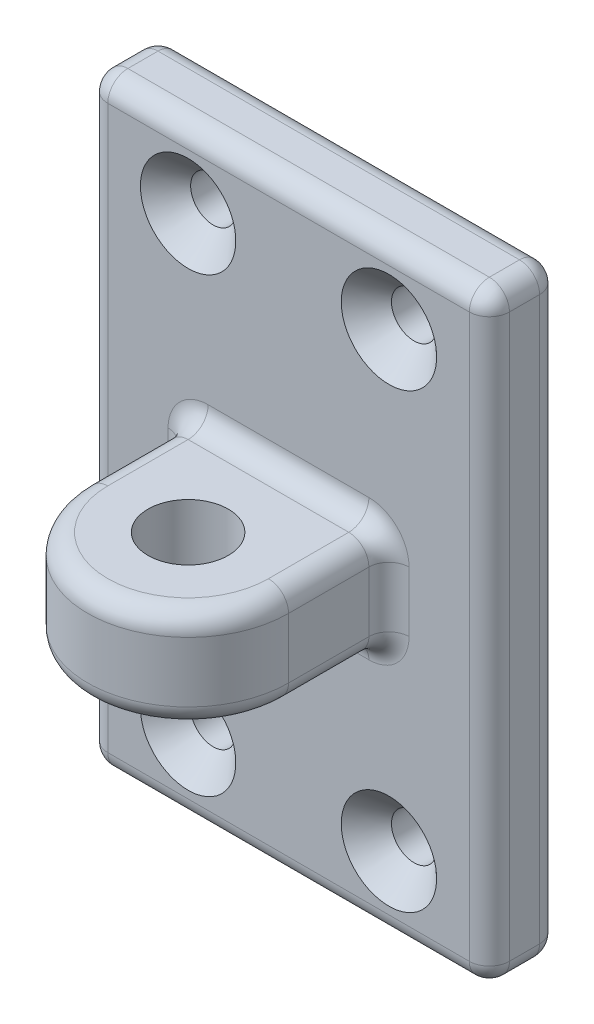
from build123d import *

# Parameters (mm, degrees)
ESQUISSE1_W             = 40
ESQUISSE1_H             = 60
ESQUISSE1_R             = 2.25
BOSS_EXTRU_1_DEPTH      = 7
BOSS_EXTRU_3_START      = -25
ESQUISSE4_R             = 4
BOSS_EXTRU_3_DEPTH      = 10
ENL_V_MAT_EXTRU_1_DEPTH = 0.3
CONG_1_R                = 2
CHANFREIN1_SIZE         = 2.5


with BuildPart() as part:
    # Esquisse1 → Boss.-Extru.1 (new body)
    with BuildSketch(Plane.XY):
        with Locations((20, 30)):
            Rectangle(ESQUISSE1_W, ESQUISSE1_H)
        with Locations((10, 52.5)):
            Circle(ESQUISSE1_R, mode=Mode.SUBTRACT)
        with Locations((30, 52.5)):
            Circle(ESQUISSE1_R, mode=Mode.SUBTRACT)
        with Locations((10, 7.5)):
            Circle(ESQUISSE1_R, mode=Mode.SUBTRACT)
        with Locations((30, 7.5)):
            Circle(ESQUISSE1_R, mode=Mode.SUBTRACT)
    extrude(amount=BOSS_EXTRU_1_DEPTH)

    # Esquisse4 → Boss.-Extru.3 (add)
    with BuildSketch(Plane(origin=(0, 60, 120), x_dir=(1, 0, 0), z_dir=(0, 1, 0)).offset(BOSS_EXTRU_3_START)):
        with BuildLine():
            Line((30, 113), (30, 103))
            ThreePointArc((30, 103), (20, 93), (10, 103))
            Line((10, 103), (10, 113))
            Line((10, 113), (30, 113))
        make_face()
        with Locations((20, 103)):
            Circle(ESQUISSE4_R, mode=Mode.SUBTRACT)
    extrude(amount=-BOSS_EXTRU_3_DEPTH)

    # Esquisse7 → Enlèv. mat.-Extru.1 (cut)
    # profile 1 of 9: a face of its own
    with BuildSketch(Plane(origin=(0, 0, 0), x_dir=(-1, 0, 0), z_dir=(0, 0, -1))):
        with BuildLine():
            add(Edge.make_bspline(
                [(-22.253937988, 36.824583435), (-22.252071419, 36.853414647), (-22.248392709, 36.910236353), (-22.211239144, 36.990034413), (-22.153139807, 37.061166535), (-22.101559217, 37.097875597), (-22.074395895, 37.117207289)],
                knots=[0, 0, 0, 0, 0.959160072, 1.890351017, 2.889018652, 4, 4, 4, 4], degree=3))
            add(Edge.make_bspline(
                [(-22.074395895, 37.117207289), (-22.044987646, 37.133814905), (-21.979332884, 37.170891885), (-21.862164241, 37.213972108), (-21.721025867, 37.258213691), (-21.617324146, 37.2819836), (-21.561560192, 37.294765491)],
                knots=[0, 0, 0, 0, 0.742751013, 1.658213032, 2.74074123, 4, 4, 4, 4], degree=3))
            Line((-21.561560192, 37.294765491), (-20.986231937, 37.412806978))
            add(Edge.make_bspline(
                [(-20.986231937, 37.412806978), (-20.962135093, 37.418933513), (-20.911131971, 37.431900872), (-20.828702203, 37.448878963), (-20.737221656, 37.470732858), (-20.634380226, 37.490645346), (-20.522212237, 37.514069733), (-20.399310947, 37.536372048), (-20.266713295, 37.561113674), (-20.124101058, 37.588494513), (-19.971082471, 37.614503687), (-19.808540982, 37.643716143), (-19.635612479, 37.673497141), (-19.45230755, 37.703832536), (-19.258993728, 37.736923927), (-19.055621681, 37.770517793), (-18.842360147, 37.80528199), (-18.69682949, 37.828476899), (-18.622426367, 37.840335388)],
                knots=[0, 0, 0, 0, 0.496658207, 1.051221438, 1.68101768, 2.375400972, 3.143623008, 3.970205625, 4.870641242, 5.838436678, 6.871229342, 7.971369117, 9.137717576, 10.376808206, 11.683232474, 13.055897193, 14.494815811, 16, 16, 16, 16], degree=3))
            Line((-18.622426367, 37.840335388), (-20.641034985, 38.520809841))
            Line((-20.641034985, 38.520809841), (-21.276871901, 38.72217473))
            add(Edge.make_bspline(
                [(-21.276871901, 38.72217473), (-21.337268664, 38.742069704), (-21.452965474, 38.780180768), (-21.615973654, 38.844604746), (-21.76301033, 38.907616934), (-21.853115764, 38.95475212), (-21.895845747, 38.977104664)],
                knots=[0, 0, 0, 0, 1.138108356, 2.180174859, 3.13699879, 4, 4, 4, 4], degree=3))
            add(Edge.make_bspline(
                [(-21.895845747, 38.977104664), (-21.914407092, 38.988832162), (-21.950432858, 39.011594095), (-21.9967196, 39.053083085), (-22.037511358, 39.095872955), (-22.070413933, 39.142591347), (-22.095402933, 39.192899624), (-22.113337786, 39.245946321), (-22.124586371, 39.301995935), (-22.126165432, 39.340434614), (-22.126968994, 39.359995537)],
                knots=[0, 0, 0, 0, 1.12138879, 2.176506675, 3.170017907, 4.141537379, 5.087232601, 6.03413754, 6.999599269, 8, 8, 8, 8], degree=3))
            add(Edge.make_bspline(
                [(-22.126968994, 39.359995537), (-22.124831457, 39.391791165), (-22.1206333, 39.454238292), (-22.082399688, 39.541624172), (-22.020741183, 39.6179114), (-21.965485769, 39.654997856), (-21.936515503, 39.674442186)],
                knots=[0, 0, 0, 0, 0.986319395, 1.937147192, 2.918451782, 4, 4, 4, 4], degree=3))
            add(Edge.make_bspline(
                [(-21.936515503, 39.674442186), (-21.91153943, 39.687008268), (-21.859402004, 39.7132399), (-21.77440459, 39.747606444), (-21.680068164, 39.780447374), (-21.61324991, 39.799444936), (-21.578423262, 39.809346743)],
                knots=[0, 0, 0, 0, 0.874803538, 1.826147944, 2.866956585, 4, 4, 4, 4], degree=3))
            Line((-21.578423262, 39.809346743), (-21.206443787, 39.906557379))
            add(Edge.make_bspline(
                [(-21.206443787, 39.906557379), (-21.006312241, 39.962347591), (-20.600305436, 40.075529179), (-19.977879553, 40.230817259), (-19.334529847, 40.375733433), (-18.897392154, 40.462658571), (-18.675991411, 40.506684265)],
                knots=[0, 0, 0, 0, 0.958328754, 1.944161251, 2.958762347, 4, 4, 4, 4], degree=3))
            Line((-18.675991411, 40.506684265), (-19.270166626, 40.624725752))
            Line((-19.270166626, 40.624725752), (-21.023925858, 41.04630249))
            add(Edge.make_bspline(
                [(-21.023925858, 41.04630249), (-21.051061327, 41.048748338), (-21.108754278, 41.053948474), (-21.199598439, 41.066458838), (-21.299898744, 41.081006332), (-21.409322648, 41.100159342), (-21.527943536, 41.1231192), (-21.655897976, 41.148961143), (-21.793225669, 41.177587805), (-21.88761048, 41.19892019), (-21.936515503, 41.209973459)],
                knots=[0, 0, 0, 0, 0.704684958, 1.498236636, 2.371575818, 3.326349705, 4.371405418, 5.496944069, 6.703053969, 8, 8, 8, 8], degree=3))
            add(Edge.make_bspline(
                [(-21.936515503, 41.209973459), (-21.956601235, 41.218405287), (-21.995168196, 41.234595385), (-22.046778651, 41.26580711), (-22.091752398, 41.299410243), (-22.127717285, 41.338602842), (-22.156070857, 41.381777224), (-22.176052784, 41.429153725), (-22.188347034, 41.480483387), (-22.189739459, 41.516083764), (-22.190453491, 41.534339561)],
                knots=[0, 0, 0, 0, 1.182980922, 2.271462135, 3.271240398, 4.225523803, 5.148115151, 6.066492127, 7.00850128, 8, 8, 8, 8], degree=3))
            add(Edge.make_bspline(
                [(-22.190453491, 41.534339561), (-22.189374089, 41.56000286), (-22.187296915, 41.609388632), (-22.164067877, 41.67867748), (-22.128132918, 41.740728445), (-22.09320304, 41.772874249), (-22.07538784, 41.789269495)],
                knots=[0, 0, 0, 0, 1.060616523, 2.041022336, 3.000867405, 4, 4, 4, 4], degree=3))
            add(Edge.make_bspline(
                [(-22.07538784, 41.789269495), (-22.058638609, 41.801919164), (-22.024814605, 41.827464362), (-21.965273111, 41.852357039), (-21.900762872, 41.869359717), (-21.855626877, 41.870838635), (-21.83236125, 41.871600952)],
                knots=[0, 0, 0, 0, 0.958743918, 1.936122096, 2.936161401, 4, 4, 4, 4], degree=3))
            add(Edge.make_bspline(
                [(-21.83236125, 41.871600952), (-21.785397772, 41.870619292), (-21.68873458, 41.868598776), (-21.540050787, 41.858811302), (-21.383638851, 41.840244312), (-21.219512745, 41.815640525), (-21.04726384, 41.783350492), (-20.867124233, 41.745162707), (-20.679575013, 41.69783347), (-20.552364136, 41.66317076), (-20.487283468, 41.645437431)],
                knots=[0, 0, 0, 0, 0.824042072, 1.69609536, 2.612788883, 3.586582681, 4.607146524, 5.686861406, 6.816605879, 8, 8, 8, 8], degree=3))
            Line((-20.487283468, 41.645437431), (-19.13724596, 41.2853613))
            Line((-19.13724596, 41.2853613), (-18.082808142, 41.095899754))
            add(Edge.make_bspline(
                [(-18.082808142, 41.095899754), (-18.023912348, 41.083858815), (-17.910869295, 41.06074775), (-17.749592823, 41.024588889), (-17.604300296, 40.987037257), (-17.475377129, 40.948311948), (-17.362259958, 40.910247812), (-17.26522103, 40.871309245), (-17.183233349, 40.833220129), (-17.136862595, 40.802460345), (-17.115661507, 40.788396721)],
                knots=[0, 0, 0, 0, 1.41391691, 2.713835346, 3.887123202, 4.942664059, 5.879701372, 6.692772478, 7.402324893, 8, 8, 8, 8], degree=3))
            add(Edge.make_bspline(
                [(-17.115661507, 40.788396721), (-17.086057886, 40.766171226), (-17.030169094, 40.724211627), (-16.967278791, 40.644034816), (-16.92770822, 40.55539417), (-16.923397914, 40.492525806), (-16.921240234, 40.461054783)],
                knots=[0, 0, 0, 0, 1.115644301, 2.106229269, 3.052004878, 4, 4, 4, 4], degree=3))
            add(Edge.make_bspline(
                [(-16.921240234, 40.461054783), (-16.921934028, 40.443451275), (-16.923286334, 40.409139405), (-16.935822172, 40.359976839), (-16.954832282, 40.314274547), (-16.982123382, 40.271743861), (-17.018488935, 40.233446633), (-17.061247641, 40.197588224), (-17.111687086, 40.165061535), (-17.149446664, 40.148395048), (-17.169226551, 40.139664516)],
                knots=[0, 0, 0, 0, 0.974792575, 1.900016553, 2.795872551, 3.711595558, 4.685006917, 5.713528267, 6.802260137, 8, 8, 8, 8], degree=3))
            add(Edge.make_bspline(
                [(-17.169226551, 40.139664516), (-17.197192493, 40.128052016), (-17.258582933, 40.10256042), (-17.362550133, 40.069541233), (-17.485682046, 40.036675724), (-17.627600747, 40.000386992), (-17.789451668, 39.965105235), (-17.97082949, 39.929868163), (-18.171204498, 39.893092016), (-18.311255926, 39.869351901), (-18.384359503, 39.856960115)],
                knots=[0, 0, 0, 0, 0.581236301, 1.275921689, 2.09225498, 3.028489211, 4.088314635, 5.272448532, 6.576281799, 8, 8, 8, 8], degree=3))
            add(Edge.make_bspline(
                [(-18.384359503, 39.856960115), (-18.477019725, 39.841525554), (-18.664674237, 39.810267642), (-18.948091238, 39.75465888), (-19.238035599, 39.695788765), (-19.533375969, 39.629350667), (-19.833942599, 39.555159628), (-20.140800989, 39.477384099), (-20.452859279, 39.391965), (-20.662274753, 39.331171905), (-20.768003979, 39.300478821)],
                knots=[0, 0, 0, 0, 0.920409794, 1.864004282, 2.829825251, 3.819421933, 4.829969225, 5.863304241, 6.92122972, 8, 8, 8, 8], degree=3))
            add(Edge.make_bspline(
                [(-20.768003979, 39.300478821), (-20.551561346, 39.21819894), (-20.11626624, 39.052723087), (-19.45125436, 38.826401862), (-18.772890769, 38.616322115), (-18.31365355, 38.491369191), (-18.082808142, 38.428558931)],
                knots=[0, 0, 0, 0, 0.983642058, 1.97823584, 2.98371701, 4, 4, 4, 4], degree=3))
            Line((-18.082808142, 38.428558931), (-17.593779125, 38.326388569))
            add(Edge.make_bspline(
                [(-17.593779125, 38.326388569), (-17.546986854, 38.316123128), (-17.457359673, 38.296460424), (-17.331476115, 38.258052006), (-17.218244361, 38.218223735), (-17.150719633, 38.1832853), (-17.118637342, 38.166685381)],
                knots=[0, 0, 0, 0, 1.142374087, 2.188134223, 3.139147904, 4, 4, 4, 4], degree=3))
            add(Edge.make_bspline(
                [(-17.118637342, 38.166685381), (-17.097803607, 38.155995248), (-17.057755338, 38.135445821), (-17.005302904, 38.096965799), (-16.959811883, 38.057371618), (-16.92227715, 38.014242045), (-16.893412052, 37.967219922), (-16.872251625, 37.917492399), (-16.859883428, 37.864410516), (-16.858476853, 37.828166486), (-16.857755737, 37.809585085)],
                knots=[0, 0, 0, 0, 1.1989224, 2.304664292, 3.325509931, 4.287341643, 5.223729972, 6.14323389, 7.048082794, 8, 8, 8, 8], degree=3))
            add(Edge.make_bspline(
                [(-16.857755737, 37.809585085), (-16.859469498, 37.78618142), (-16.862914819, 37.739131025), (-16.891678827, 37.671748551), (-16.938178183, 37.61045715), (-17.00136723, 37.55302969), (-17.082989808, 37.501156698), (-17.181544506, 37.452962668), (-17.297916687, 37.409271331), (-17.382283408, 37.385673599), (-17.42713232, 37.373129168)],
                knots=[0, 0, 0, 0, 0.729436865, 1.466449471, 2.249901209, 3.120352387, 4.120811242, 5.2624927, 6.544755269, 8, 8, 8, 8], degree=3))
            add(Edge.make_bspline(
                [(-17.42713232, 37.373129168), (-17.444939994, 37.368298777), (-17.484909768, 37.357456844), (-17.552042615, 37.344587488), (-17.631679301, 37.329481726), (-17.723880479, 37.31350946), (-17.829149377, 37.298044594), (-17.946865275, 37.28121203), (-18.077455378, 37.263217182), (-18.168767781, 37.251382989), (-18.216720753, 37.245168228)],
                knots=[0, 0, 0, 0, 0.553116127, 1.241483132, 2.04851274, 2.984162884, 4.047067603, 5.238941889, 6.55002235, 8, 8, 8, 8], degree=3))
            add(Edge.make_bspline(
                [(-18.216720753, 37.245168228), (-18.34078334, 37.229127677), (-18.584221989, 37.197652515), (-18.941743464, 37.142902618), (-19.285650796, 37.088671827), (-19.615361696, 37.028041086), (-19.931876049, 36.967734403), (-20.234135141, 36.901368997), (-20.523313883, 36.835162291), (-20.710270582, 36.785428697), (-20.801730118, 36.761098938)],
                knots=[0, 0, 0, 0, 1.140679443, 2.238269145, 3.298055813, 4.315294308, 5.295118381, 6.236017322, 7.137056661, 8, 8, 8, 8], degree=3))
            Line((-20.801730118, 36.761098938), (-21.377058372, 36.600403805))
            add(Edge.make_bspline(
                [(-21.377058372, 36.600403805), (-21.412385078, 36.59028752), (-21.479247802, 36.571140465), (-21.575135116, 36.546920471), (-21.659765477, 36.524313883), (-21.73447518, 36.508096482), (-21.797789566, 36.493676801), (-21.850383071, 36.483803644), (-21.892371036, 36.47704518), (-21.91699083, 36.475908126), (-21.927587996, 36.475418701)],
                knots=[0, 0, 0, 0, 1.559836002, 2.952295785, 4.198319056, 5.277771974, 6.19735914, 6.954427167, 7.549951206, 8, 8, 8, 8], degree=3))
            add(Edge.make_bspline(
                [(-21.927587996, 36.475418701), (-21.949886053, 36.476786524), (-21.993747771, 36.479477119), (-22.056786135, 36.499920679), (-22.113351769, 36.534718451), (-22.162402083, 36.581403), (-22.202438568, 36.636055357), (-22.23176939, 36.695843744), (-22.25062122, 36.75897589), (-22.252828206, 36.802631313), (-22.253937988, 36.824583435)],
                knots=[0, 0, 0, 0, 1.009991958, 1.986719327, 2.968954602, 3.997799753, 5.038376203, 6.024038288, 7.006387982, 8, 8, 8, 8], degree=3))
        make_face()
    # profile 2 of 9: a face of its own
    with BuildSketch(Plane(origin=(0, 0, 0), x_dir=(-1, 0, 0), z_dir=(0, 0, -1))):
        with BuildLine():
            add(Edge.make_bspline(
                [(-17.746538696, 35.203744869), (-17.745292914, 35.22903295), (-17.742854226, 35.278535736), (-17.720852992, 35.349771424), (-17.685396961, 35.415412113), (-17.637042851, 35.474038603), (-17.579059821, 35.524056172), (-17.51289209, 35.559555183), (-17.441292019, 35.583359493), (-17.391287813, 35.58552478), (-17.365631714, 35.586635742)],
                knots=[0, 0, 0, 0, 1.011043888, 1.979173117, 2.957131321, 3.983335684, 5.007828563, 6.003745504, 6.975764089, 8, 8, 8, 8], degree=3))
            add(Edge.make_bspline(
                [(-17.365631714, 35.586635742), (-17.339984089, 35.585509899), (-17.289996401, 35.583315609), (-17.218554589, 35.559813553), (-17.153072548, 35.52371159), (-17.095109154, 35.474122693), (-17.047064643, 35.41511353), (-17.010192798, 35.350071328), (-16.988478377, 35.27849736), (-16.985993904, 35.229019974), (-16.984724731, 35.203744869)],
                knots=[0, 0, 0, 0, 1.024909736, 1.997567794, 2.98252313, 4.007690004, 5.034569487, 6.019524822, 6.988290965, 8, 8, 8, 8], degree=3))
            add(Edge.make_bspline(
                [(-16.984724731, 35.203744869), (-16.985990643, 35.178467347), (-16.988468734, 35.128985229), (-17.01022972, 35.057445786), (-17.046794887, 34.99249335), (-17.095186411, 34.934328313), (-17.153123021, 34.88571462), (-17.218632454, 34.850540702), (-17.290162582, 34.828397901), (-17.340007445, 34.82603599), (-17.365631714, 34.824821777)],
                knots=[0, 0, 0, 0, 1.015389577, 1.987680038, 2.976218587, 3.99656407, 5.016909553, 5.999071237, 6.971361698, 8, 8, 8, 8], degree=3))
            add(Edge.make_bspline(
                [(-17.365631714, 34.824821777), (-17.391264216, 34.82602111), (-17.441125097, 34.828354077), (-17.512820662, 34.850793462), (-17.579002032, 34.885374307), (-17.636967689, 34.934410915), (-17.685662311, 34.992197384), (-17.720815854, 35.057745791), (-17.742863952, 35.128946807), (-17.745296202, 35.178454356), (-17.746538696, 35.203744869)],
                knots=[0, 0, 0, 0, 1.02794996, 1.999589787, 2.992820247, 4.012482938, 5.032145629, 6.013650072, 6.985289899, 8, 8, 8, 8], degree=3))
        make_face()
    # profile 3 of 9: a face of its own
    with BuildSketch(Plane(origin=(0, 0, 0), x_dir=(-1, 0, 0), z_dir=(0, 0, -1))):
        with BuildLine():
            add(Edge.make_bspline(
                [(-20.470420399, 35.015275269), (-20.50778367, 35.015275269), (-20.591107073, 35.015275269), (-20.728326168, 35.015275269), (-20.890674543, 35.015275269), (-21.069224691, 35.015275269), (-21.247774839, 35.015275269), (-21.409461918, 35.015275269), (-21.546350365, 35.015275269), (-21.629343119, 35.015275269), (-21.66670639, 35.015275269)],
                knots=[0, 0, 0, 0, 0.749585406, 1.671641791, 2.752902156, 4.006633499, 5.253731343, 6.334991708, 7.250414594, 8, 8, 8, 8], degree=3))
            add(Edge.make_bspline(
                [(-21.66670639, 35.015275269), (-21.690275956, 35.016461955), (-21.735346654, 35.018731185), (-21.80021069, 35.034952184), (-21.857774447, 35.062839505), (-21.908386629, 35.100963529), (-21.948948415, 35.148436345), (-21.978571102, 35.203900782), (-21.996865683, 35.266091649), (-21.998935983, 35.310086747), (-22, 35.332697754)],
                knots=[0, 0, 0, 0, 1.094717351, 2.093363834, 3.08286838, 4.047734091, 5.017601985, 5.959315965, 6.95120314, 8, 8, 8, 8], degree=3))
            add(Edge.make_bspline(
                [(-22, 35.332697754), (-21.998949762, 35.354986778), (-21.99690655, 35.398349513), (-21.978339825, 35.459761408), (-21.949005289, 35.515022049), (-21.908103466, 35.562441106), (-21.857869985, 35.601494496), (-21.800446387, 35.630631282), (-21.735320713, 35.646602045), (-21.690267048, 35.648912168), (-21.66670639, 35.650120239)],
                knots=[0, 0, 0, 0, 1.035292228, 2.01413497, 2.957488023, 3.929043993, 4.904978555, 5.902992621, 6.903377269, 8, 8, 8, 8], degree=3))
            add(Edge.make_bspline(
                [(-21.66670639, 35.650120239), (-21.629343119, 35.650120239), (-21.546350365, 35.650120239), (-21.409461918, 35.650120239), (-21.247774839, 35.650120239), (-21.069224691, 35.650120239), (-20.890674543, 35.650120239), (-20.728326168, 35.650120239), (-20.591107073, 35.650120239), (-20.50778367, 35.650120239), (-20.470420399, 35.650120239)],
                knots=[0, 0, 0, 0, 0.749585406, 1.665008292, 2.746268657, 3.993366501, 5.247097844, 6.328358209, 7.250414594, 8, 8, 8, 8], degree=3))
            add(Edge.make_bspline(
                [(-20.470420399, 35.650120239), (-20.415197601, 35.649693656), (-20.298111112, 35.648789191), (-20.11259634, 35.642337347), (-19.907568936, 35.632515748), (-19.689759474, 35.618378018), (-19.471950011, 35.604240128), (-19.26692261, 35.594418956), (-19.081077373, 35.587954275), (-18.963660102, 35.587059219), (-18.908106604, 35.586635742)],
                knots=[0, 0, 0, 0, 0.847472393, 1.796858752, 2.848468188, 3.99746302, 5.146457853, 6.198067289, 7.147453648, 8, 8, 8, 8], degree=3))
            add(Edge.make_bspline(
                [(-18.908106604, 35.586635742), (-18.884242991, 35.58535567), (-18.838269394, 35.582889593), (-18.772097528, 35.567853207), (-18.71473363, 35.537346334), (-18.663658553, 35.499411194), (-18.623146987, 35.451176662), (-18.591986287, 35.396769695), (-18.57533105, 35.334634276), (-18.573025001, 35.291454898), (-18.571837158, 35.269213257)],
                knots=[0, 0, 0, 0, 1.105496077, 2.129754222, 3.108305544, 4.090677482, 5.056586269, 6.001791546, 6.970725423, 8, 8, 8, 8], degree=3))
            add(Edge.make_bspline(
                [(-18.571837158, 35.269213257), (-18.572969044, 35.24695182), (-18.57515026, 35.204052609), (-18.592465039, 35.142204897), (-18.622789205, 35.087366116), (-18.663746984, 35.039138256), (-18.714432066, 35.000781293), (-18.772547969, 34.972107521), (-18.8380588, 34.955116841), (-18.884198849, 34.95292598), (-18.908106604, 34.951790771)],
                knots=[0, 0, 0, 0, 1.029841539, 1.984570475, 2.943708136, 3.910148981, 4.893062045, 5.865305939, 6.893894976, 8, 8, 8, 8], degree=3))
            add(Edge.make_bspline(
                [(-18.908106604, 34.951790771), (-18.963660102, 34.952214248), (-19.081077373, 34.953109304), (-19.26692261, 34.959573985), (-19.471950011, 34.969395157), (-19.689759474, 34.983533048), (-19.907568936, 34.997670778), (-20.11259634, 35.007492376), (-20.298111112, 35.01394422), (-20.415197601, 35.014848686), (-20.470420399, 35.015275269)],
                knots=[0, 0, 0, 0, 0.852546352, 1.801932711, 2.853542147, 4.00253698, 5.151531812, 6.203141248, 7.152527607, 8, 8, 8, 8], degree=3))
        make_face()
    # profile 4 of 9: a face of its own
    with BuildSketch(Plane(origin=(0, 0, 0), x_dir=(-1, 0, 0), z_dir=(0, 0, -1))):
        with BuildLine():
            add(Edge.make_bspline(
                [(-22.253937988, 31.306391916), (-22.253143175, 31.330631914), (-22.251634328, 31.376648284), (-22.236112179, 31.441251435), (-22.212716634, 31.498582209), (-22.177226856, 31.546729022), (-22.132212177, 31.586519348), (-22.077815231, 31.617285384), (-22.013569828, 31.639425687), (-21.967103842, 31.646726154), (-21.942467175, 31.650596924)],
                knots=[0, 0, 0, 0, 1.120660435, 2.127422838, 3.060545721, 3.970376627, 4.870878344, 5.824514606, 6.846538862, 8, 8, 8, 8], degree=3))
            Line((-21.942467175, 31.650596924), (-21.216363239, 31.734912271))
            add(Edge.make_bspline(
                [(-21.216363239, 31.734912271), (-21.152583858, 31.741601794), (-21.027484814, 31.754722851), (-20.842521842, 31.767133003), (-20.663927713, 31.775582013), (-20.546809438, 31.776912318), (-20.489267359, 31.777565918)],
                knots=[0, 0, 0, 0, 1.056006236, 2.071286475, 3.052392247, 4, 4, 4, 4], degree=3))
            add(Edge.make_bspline(
                [(-20.489267359, 31.777565918), (-20.471081372, 31.777259803), (-20.429413499, 31.776558431), (-20.358961679, 31.774719041), (-20.272362522, 31.770256406), (-20.174815314, 31.765797354), (-20.076981985, 31.760556744), (-19.98999275, 31.757909138), (-19.919238013, 31.755707734), (-19.87756872, 31.755041817), (-19.859382114, 31.754751177)],
                knots=[0, 0, 0, 0, 0.692528654, 1.586727018, 2.683157443, 3.993962047, 5.304766651, 6.413272982, 7.307471346, 8, 8, 8, 8], degree=3))
            add(Edge.make_bspline(
                [(-19.859382114, 31.754751177), (-19.803478631, 31.755344006), (-19.698772931, 31.756454358), (-19.552771952, 31.768741231), (-19.428865545, 31.790126107), (-19.32694406, 31.818395751), (-19.246449485, 31.856036476), (-19.187003166, 31.90257533), (-19.149109538, 31.96139506), (-19.145162469, 32.004891706), (-19.143197632, 32.02654418)],
                knots=[0, 0, 0, 0, 1.610028399, 3.015539292, 4.214974549, 5.227582408, 6.053934297, 6.757560469, 7.381518064, 8, 8, 8, 8], degree=3))
            add(Edge.make_bspline(
                [(-19.143197632, 32.02654418), (-19.144537355, 32.058401161), (-19.147231256, 32.12245883), (-19.169273433, 32.217600869), (-19.204039994, 32.311419103), (-19.253955127, 32.403558488), (-19.316489389, 32.494624972), (-19.393219831, 32.584663334), (-19.483188187, 32.673984978), (-19.55135477, 32.729108672), (-19.586597166, 32.757607841)],
                knots=[0, 0, 0, 0, 0.862908479, 1.73512694, 2.634339985, 3.568791753, 4.56840037, 5.624425298, 6.771818386, 8, 8, 8, 8], degree=3))
            add(Edge.make_bspline(
                [(-19.586597166, 32.757607841), (-19.621071006, 32.783403836), (-19.690719184, 32.83551999), (-19.80120407, 32.908530195), (-19.919755046, 32.97492544), (-20.042985216, 33.040235656), (-20.174441453, 33.098335149), (-20.311470902, 33.153982844), (-20.455892616, 33.20466036), (-20.554944926, 33.23445734), (-20.605324955, 33.249612694)],
                knots=[0, 0, 0, 0, 0.907885794, 1.83421954, 2.789873648, 3.772244316, 4.774021227, 5.818912256, 6.890654207, 8, 8, 8, 8], degree=3))
            add(Edge.make_bspline(
                [(-20.605324955, 33.249612694), (-20.628469446, 33.25127081), (-20.677413967, 33.254777292), (-20.754894861, 33.260223306), (-20.840464382, 33.269705326), (-20.900268144, 33.27669321), (-20.931674948, 33.280362997)],
                knots=[0, 0, 0, 0, 0.849325914, 1.796101322, 2.842590997, 4, 4, 4, 4], degree=3))
            add(Edge.make_bspline(
                [(-20.931674948, 33.280362997), (-20.986173741, 33.286563496), (-21.093627394, 33.298788837), (-21.201759763, 33.300399894), (-21.255049105, 33.301193848)],
                knots=[0, 0, 0, 0, 1.014368362, 2, 2, 2, 2], degree=3))
            add(Edge.make_bspline(
                [(-21.255049105, 33.301193848), (-21.273570222, 33.301013514), (-21.314946672, 33.300610646), (-21.38341835, 33.296211941), (-21.464710013, 33.288963696), (-21.554302065, 33.280553223), (-21.643793206, 33.271240628), (-21.724873426, 33.265812138), (-21.79362013, 33.261028818), (-21.835330714, 33.260681211), (-21.854184046, 33.260524092)],
                knots=[0, 0, 0, 0, 0.739853185, 1.65284295, 2.739966305, 4.000493185, 5.247870011, 6.333949561, 7.246939326, 8, 8, 8, 8], degree=3))
            add(Edge.make_bspline(
                [(-21.854184046, 33.260524092), (-21.87809104, 33.261660095), (-21.924229623, 33.26385249), (-21.98975068, 33.280832478), (-22.047830218, 33.30954427), (-22.098853685, 33.347912998), (-22.13912892, 33.396571527), (-22.168851153, 33.451825545), (-22.187246879, 33.512980672), (-22.189370061, 33.55599629), (-22.190453491, 33.577946577)],
                knots=[0, 0, 0, 0, 1.106844813, 2.136121794, 3.109015947, 4.092586406, 5.071372934, 6.010386962, 6.98472744, 8, 8, 8, 8], degree=3))
            add(Edge.make_bspline(
                [(-22.190453491, 33.577946577), (-22.189452046, 33.600582575), (-22.187517575, 33.644308058), (-22.168487676, 33.706148859), (-22.14008262, 33.762045743), (-22.098018474, 33.808854609), (-22.048012032, 33.847962077), (-21.988654148, 33.874469648), (-21.923350925, 33.892416099), (-21.877129729, 33.893708033), (-21.853192101, 33.894377117)],
                knots=[0, 0, 0, 0, 1.042299657, 2.013388355, 2.96274755, 3.915048982, 4.895336855, 5.872170274, 6.898012127, 8, 8, 8, 8], degree=3))
            add(Edge.make_bspline(
                [(-21.853192101, 33.894377117), (-21.834340142, 33.89455149), (-21.792632596, 33.894937269), (-21.723831516, 33.899366817), (-21.642536208, 33.906570278), (-21.552632799, 33.91521002), (-21.462728736, 33.923838014), (-21.381106241, 33.931099655), (-21.311969943, 33.935456427), (-21.269932965, 33.935858505), (-21.251081324, 33.936038818)],
                knots=[0, 0, 0, 0, 0.749259206, 1.657640177, 2.739275709, 3.993439419, 5.24760313, 6.329238662, 7.250740794, 8, 8, 8, 8], degree=3))
            add(Edge.make_bspline(
                [(-21.251081324, 33.936038818), (-21.220990438, 33.936206716), (-21.158156633, 33.936557309), (-21.059973492, 33.933672177), (-20.953466251, 33.93260841), (-20.838447795, 33.927611761), (-20.715054115, 33.924675841), (-20.583525489, 33.917639016), (-20.443583578, 33.912715885), (-20.297863518, 33.90377686), (-20.15198064, 33.8978977), (-20.011860939, 33.889915613), (-19.880193568, 33.885963367), (-19.756920169, 33.879959896), (-19.641804424, 33.877940715), (-19.535038806, 33.874022367), (-19.436479903, 33.873714082), (-19.373658749, 33.872929904), (-19.343570576, 33.872554321)],
                knots=[0, 0, 0, 0, 0.756649984, 1.579986608, 2.469829357, 3.434923482, 4.47480987, 5.573501345, 6.746954068, 7.995951889, 9.244534489, 10.41837011, 11.525024358, 12.556901746, 13.52174511, 14.420093674, 15.243304331, 16, 16, 16, 16], degree=3))
            add(Edge.make_bspline(
                [(-19.343570576, 33.872554321), (-19.323399893, 33.872834488), (-19.279084711, 33.873450016), (-19.20601524, 33.875671082), (-19.120344842, 33.878274813), (-19.025824422, 33.883629985), (-18.931585475, 33.888124842), (-18.845647196, 33.892608961), (-18.772877798, 33.894387304), (-18.728564777, 33.895065452), (-18.708725605, 33.895369062)],
                knots=[0, 0, 0, 0, 0.762046719, 1.674223902, 2.761577294, 3.999751615, 5.250401086, 6.325779014, 7.250442466, 8, 8, 8, 8], degree=3))
            add(Edge.make_bspline(
                [(-18.708725605, 33.895369062), (-18.685770846, 33.894372579), (-18.641007285, 33.892429359), (-18.577227515, 33.872914062), (-18.520115441, 33.840540113), (-18.472038734, 33.795025576), (-18.43148242, 33.742386985), (-18.401728213, 33.682174588), (-18.384820806, 33.615564018), (-18.382551445, 33.569114544), (-18.381383667, 33.545212383)],
                knots=[0, 0, 0, 0, 1.026010766, 2.000800635, 2.956263305, 3.941799919, 4.946194384, 5.920083338, 6.929707924, 8, 8, 8, 8], degree=3))
            add(Edge.make_bspline(
                [(-18.381383667, 33.545212383), (-18.382716002, 33.519313334), (-18.385270543, 33.469656044), (-18.404773412, 33.399054798), (-18.441070475, 33.339473429), (-18.48901204, 33.287769148), (-18.551957594, 33.247352538), (-18.628093757, 33.216838337), (-18.717309266, 33.195146653), (-18.781674732, 33.188608373), (-18.815855694, 33.185136251)],
                knots=[0, 0, 0, 0, 0.981438758, 1.881752029, 2.741463425, 3.601448804, 4.532970262, 5.550009211, 6.698944533, 8, 8, 8, 8], degree=3))
            Line((-18.815855694, 33.185136251), (-19.206682129, 33.174224854))
            add(Edge.make_bspline(
                [(-19.206682129, 33.174224854), (-19.146462375, 33.1271286), (-19.030753479, 33.036635776), (-18.874821885, 32.892320215), (-18.742961129, 32.746459995), (-18.634999295, 32.599346109), (-18.549693416, 32.45139852), (-18.4899661, 32.301791207), (-18.451748285, 32.150787604), (-18.447152615, 32.049245197), (-18.444868164, 31.998769712)],
                knots=[0, 0, 0, 0, 1.263598251, 2.427933541, 3.508005564, 4.509617483, 5.439945349, 6.323141168, 7.166454043, 8, 8, 8, 8], degree=3))
            add(Edge.make_bspline(
                [(-18.444868164, 31.998769712), (-18.445919483, 31.955006524), (-18.447958205, 31.870140781), (-18.471683479, 31.748470188), (-18.50804288, 31.636597098), (-18.560257803, 31.535103618), (-18.627304738, 31.444081425), (-18.70926903, 31.363449612), (-18.805977103, 31.293495346), (-18.878752039, 31.257423153), (-18.916042166, 31.238939638)],
                knots=[0, 0, 0, 0, 1.102560814, 2.138090143, 3.114024346, 4.061564928, 5.004136339, 5.953730576, 6.951484528, 8, 8, 8, 8], degree=3))
            add(Edge.make_bspline(
                [(-18.916042166, 31.238939638), (-18.943619009, 31.226844199), (-19.000808833, 31.201760255), (-19.094255095, 31.173073447), (-19.195943636, 31.145802844), (-19.307752054, 31.124514813), (-19.428561551, 31.106877308), (-19.558900863, 31.092749646), (-19.69860888, 31.084495548), (-19.794898684, 31.081024553), (-19.844502935, 31.07923645)],
                knots=[0, 0, 0, 0, 0.76165536, 1.579547541, 2.470768388, 3.426104039, 4.458278625, 5.560971179, 6.743520153, 8, 8, 8, 8], degree=3))
            Line((-19.844502935, 31.07923645), (-20.182756271, 31.07923645))
            Line((-20.182756271, 31.07923645), (-20.49323514, 31.083204231))
            add(Edge.make_bspline(
                [(-20.49323514, 31.083204231), (-20.542850334, 31.082324255), (-20.648815964, 31.080444845), (-20.817923916, 31.067750097), (-21.007083433, 31.046634773), (-21.209433451, 31.017875583), (-21.411342835, 30.988357977), (-21.60037096, 30.969371423), (-21.768650353, 30.954714518), (-21.874327329, 30.953045819), (-21.923620214, 30.952267456)],
                knots=[0, 0, 0, 0, 0.828340741, 1.76912841, 2.829861241, 4.005596384, 5.181331526, 6.235985114, 7.177177593, 8, 8, 8, 8], degree=3))
            add(Edge.make_bspline(
                [(-21.923620214, 30.952267456), (-21.947296368, 30.95305836), (-21.992935873, 30.95458295), (-22.056850733, 30.976409058), (-22.115384345, 31.006827248), (-22.164238504, 31.052100404), (-22.204283747, 31.105963056), (-22.233387384, 31.167247881), (-22.250535011, 31.235046178), (-22.252781972, 31.282155236), (-22.253937988, 31.306391916)],
                knots=[0, 0, 0, 0, 1.042822364, 2.010203863, 2.959819381, 3.94432012, 4.92784131, 5.916358886, 6.928007818, 8, 8, 8, 8], degree=3))
        make_face()
    # profile 5 of 9: a face of its own
    with BuildSketch(Plane(origin=(0, 0, 0), x_dir=(-1, 0, 0), z_dir=(0, 0, -1))):
        with BuildLine():
            add(Edge.make_bspline(
                [(-17.746538696, 29.680593624), (-17.745292914, 29.705881705), (-17.742854226, 29.755384491), (-17.720852992, 29.826620179), (-17.685396961, 29.892260868), (-17.637042851, 29.950887358), (-17.579059821, 30.000904927), (-17.51289209, 30.036403938), (-17.441292019, 30.060208248), (-17.391287813, 30.062373534), (-17.365631714, 30.063484497)],
                knots=[0, 0, 0, 0, 1.011043888, 1.979173117, 2.957131321, 3.983335684, 5.007828563, 6.003745504, 6.975764089, 8, 8, 8, 8], degree=3))
            add(Edge.make_bspline(
                [(-17.365631714, 30.063484497), (-17.339984089, 30.062358654), (-17.289996401, 30.060164364), (-17.218554589, 30.036662308), (-17.153072548, 30.000560344), (-17.095109154, 29.950971448), (-17.047064643, 29.891962284), (-17.010192798, 29.826920082), (-16.988478377, 29.755346115), (-16.985993904, 29.705868729), (-16.984724731, 29.680593624)],
                knots=[0, 0, 0, 0, 1.024909736, 1.997567794, 2.98252313, 4.007690004, 5.034569487, 6.019524822, 6.988290965, 8, 8, 8, 8], degree=3))
            add(Edge.make_bspline(
                [(-16.984724731, 29.680593624), (-16.985990643, 29.655316102), (-16.988468734, 29.605833984), (-17.01022972, 29.534294541), (-17.046794887, 29.469342105), (-17.095186411, 29.411177068), (-17.153123021, 29.362563375), (-17.218632454, 29.327389457), (-17.290162582, 29.305246656), (-17.340007445, 29.302884744), (-17.365631714, 29.301670532)],
                knots=[0, 0, 0, 0, 1.015389577, 1.987680038, 2.976218587, 3.99656407, 5.016909553, 5.999071237, 6.971361698, 8, 8, 8, 8], degree=3))
            add(Edge.make_bspline(
                [(-17.365631714, 29.301670532), (-17.391264216, 29.302869865), (-17.441125097, 29.305202832), (-17.512820662, 29.327642217), (-17.579002032, 29.362223062), (-17.636967689, 29.41125967), (-17.685662311, 29.469046139), (-17.720815854, 29.534594546), (-17.742863952, 29.605795562), (-17.745296202, 29.655303111), (-17.746538696, 29.680593624)],
                knots=[0, 0, 0, 0, 1.02794996, 1.999589787, 2.992820247, 4.012482938, 5.032145629, 6.013650072, 6.985289899, 8, 8, 8, 8], degree=3))
        make_face()
    # profile 6 of 9: a face of its own
    with BuildSketch(Plane(origin=(0, 0, 0), x_dir=(-1, 0, 0), z_dir=(0, 0, -1))):
        with BuildLine():
            add(Edge.make_bspline(
                [(-20.470420399, 29.492124023), (-20.50778367, 29.492124023), (-20.591107073, 29.492124023), (-20.728326168, 29.492124023), (-20.890674543, 29.492124023), (-21.069224691, 29.492124023), (-21.247774839, 29.492124023), (-21.409461918, 29.492124023), (-21.546350365, 29.492124023), (-21.629343119, 29.492124023), (-21.66670639, 29.492124023)],
                knots=[0, 0, 0, 0, 0.749585406, 1.671641791, 2.752902156, 4.006633499, 5.253731343, 6.334991708, 7.250414594, 8, 8, 8, 8], degree=3))
            add(Edge.make_bspline(
                [(-21.66670639, 29.492124023), (-21.690275956, 29.493310709), (-21.735346654, 29.49557994), (-21.80021069, 29.511800939), (-21.857774447, 29.53968826), (-21.908386629, 29.577812284), (-21.948948415, 29.6252851), (-21.978571102, 29.680749537), (-21.996865683, 29.742940404), (-21.998935983, 29.786935502), (-22, 29.809546509)],
                knots=[0, 0, 0, 0, 1.094717351, 2.093363834, 3.08286838, 4.047734091, 5.017601985, 5.959315965, 6.95120314, 8, 8, 8, 8], degree=3))
            add(Edge.make_bspline(
                [(-22, 29.809546509), (-21.998949762, 29.831835533), (-21.99690655, 29.875198268), (-21.978339825, 29.936610163), (-21.949005289, 29.991870804), (-21.908103466, 30.039289861), (-21.857869985, 30.078343251), (-21.800446387, 30.107480036), (-21.735320713, 30.1234508), (-21.690267048, 30.125760923), (-21.66670639, 30.126968994)],
                knots=[0, 0, 0, 0, 1.035292228, 2.01413497, 2.957488023, 3.929043993, 4.904978555, 5.902992621, 6.903377269, 8, 8, 8, 8], degree=3))
            add(Edge.make_bspline(
                [(-21.66670639, 30.126968994), (-21.629343119, 30.126968994), (-21.546350365, 30.126968994), (-21.409461918, 30.126968994), (-21.247774839, 30.126968994), (-21.069224691, 30.126968994), (-20.890674543, 30.126968994), (-20.728326168, 30.126968994), (-20.591107073, 30.126968994), (-20.50778367, 30.126968994), (-20.470420399, 30.126968994)],
                knots=[0, 0, 0, 0, 0.749585406, 1.665008292, 2.746268657, 3.993366501, 5.247097844, 6.328358209, 7.250414594, 8, 8, 8, 8], degree=3))
            add(Edge.make_bspline(
                [(-20.470420399, 30.126968994), (-20.415197601, 30.126542411), (-20.298111112, 30.125637946), (-20.11259634, 30.119186102), (-19.907568936, 30.109364503), (-19.689759474, 30.095226773), (-19.471950011, 30.081088883), (-19.26692261, 30.071267711), (-19.081077373, 30.06480303), (-18.963660102, 30.063907974), (-18.908106604, 30.063484497)],
                knots=[0, 0, 0, 0, 0.847472393, 1.796858752, 2.848468188, 3.99746302, 5.146457853, 6.198067289, 7.147453648, 8, 8, 8, 8], degree=3))
            add(Edge.make_bspline(
                [(-18.908106604, 30.063484497), (-18.884242991, 30.062204425), (-18.838269394, 30.059738348), (-18.772097528, 30.044701962), (-18.71473363, 30.014195089), (-18.663658553, 29.976259949), (-18.623146987, 29.928025417), (-18.591986287, 29.87361845), (-18.57533105, 29.811483031), (-18.573025001, 29.768303653), (-18.571837158, 29.746062012)],
                knots=[0, 0, 0, 0, 1.105496077, 2.129754222, 3.108305544, 4.090677482, 5.056586269, 6.001791546, 6.970725423, 8, 8, 8, 8], degree=3))
            add(Edge.make_bspline(
                [(-18.571837158, 29.746062012), (-18.572969044, 29.723800575), (-18.57515026, 29.680901364), (-18.592465039, 29.619053652), (-18.622789205, 29.564214871), (-18.663746984, 29.515987011), (-18.714432066, 29.477630048), (-18.772547969, 29.448956276), (-18.8380588, 29.431965596), (-18.884198849, 29.429774735), (-18.908106604, 29.428639526)],
                knots=[0, 0, 0, 0, 1.029841539, 1.984570475, 2.943708136, 3.910148981, 4.893062045, 5.865305939, 6.893894976, 8, 8, 8, 8], degree=3))
            add(Edge.make_bspline(
                [(-18.908106604, 29.428639526), (-18.963660102, 29.429063003), (-19.081077373, 29.429958059), (-19.26692261, 29.43642274), (-19.471950011, 29.446243912), (-19.689759474, 29.460381802), (-19.907568936, 29.474519532), (-20.11259634, 29.484341131), (-20.298111112, 29.490792975), (-20.415197601, 29.49169744), (-20.470420399, 29.492124023)],
                knots=[0, 0, 0, 0, 0.852546352, 1.801932711, 2.853542147, 4.00253698, 5.151531812, 6.203141248, 7.152527607, 8, 8, 8, 8], degree=3))
        make_face()
    # profile 7 of 9: a face of its own
    with BuildSketch(Plane(origin=(0, 0, 0), x_dir=(-1, 0, 0), z_dir=(0, 0, -1))):
        with BuildLine():
            add(Edge.make_bspline(
                [(-17.302147217, 26.035194769), (-17.302691059, 26.067987791), (-17.303756547, 26.1322354), (-17.318477797, 26.225511018), (-17.339995964, 26.313727707), (-17.370411143, 26.396260753), (-17.411182884, 26.472764902), (-17.459276928, 26.544012041), (-17.516942153, 26.609639361), (-17.583514254, 26.668829611), (-17.658806358, 26.722707291), (-17.742333597, 26.771552397), (-17.8353535, 26.813719378), (-17.936444957, 26.852046804), (-18.047468281, 26.881532991), (-18.166261574, 26.909274725), (-18.294392888, 26.928267795), (-18.382669712, 26.937230079), (-18.428005095, 26.941832743)],
                knots=[0, 0, 0, 0, 0.972349374, 1.905012718, 2.795197335, 3.664693702, 4.507530324, 5.362224483, 6.210641734, 7.093275141, 8.00023341, 8.954587717, 9.960097332, 11.028304447, 12.159309855, 13.366395416, 14.647487896, 16, 16, 16, 16], degree=3))
            Line((-18.428005095, 26.941832743), (-18.635321655, 26.952744141))
            add(Edge.make_bspline(
                [(-18.635321655, 26.952744141), (-18.631915814, 26.909767127), (-18.625420547, 26.827805828), (-18.617675879, 26.71038623), (-18.610878897, 26.604901356), (-18.604460211, 26.511372239), (-18.600767216, 26.429995934), (-18.597681074, 26.360233625), (-18.595618887, 26.302368317), (-18.594946439, 26.267641532), (-18.594651899, 26.252430782)],
                knots=[0, 0, 0, 0, 1.474762794, 2.812514531, 4.025369478, 5.09075914, 6.01935696, 6.811847758, 7.479575012, 8, 8, 8, 8], degree=3))
            add(Edge.make_bspline(
                [(-18.594651899, 26.252430782), (-18.595335067, 26.212682605), (-18.596611139, 26.138437995), (-18.61271589, 26.034863223), (-18.637353278, 25.94680218), (-18.673306226, 25.873749368), (-18.720590037, 25.81641385), (-18.779338727, 25.775016647), (-18.849087105, 25.750535426), (-18.898979606, 25.747907591), (-18.924969673, 25.746538696)],
                knots=[0, 0, 0, 0, 1.394593857, 2.604926377, 3.670407802, 4.594747682, 5.443661674, 6.252228518, 7.089548603, 8, 8, 8, 8], degree=3))
            add(Edge.make_bspline(
                [(-18.924969673, 25.746538696), (-18.943878872, 25.747257886), (-18.980448511, 25.748648771), (-19.032304829, 25.760447131), (-19.07820595, 25.780570043), (-19.117730421, 25.808957287), (-19.151279728, 25.845667599), (-19.177806944, 25.890682111), (-19.197656719, 25.943541102), (-19.206170788, 25.981499368), (-19.21064991, 26.00146863)],
                knots=[0, 0, 0, 0, 1.071453586, 2.07214866, 2.995543921, 3.89580243, 4.811550393, 5.795592626, 6.840295107, 8, 8, 8, 8], degree=3))
            add(Edge.make_bspline(
                [(-19.21064991, 26.00146863), (-19.21636887, 26.041739131), (-19.228607948, 26.127921556), (-19.225403666, 26.229965056), (-19.225430098, 26.310624226), (-19.226368643, 26.369505485), (-19.229493569, 26.442587883), (-19.234809285, 26.529843517), (-19.240462567, 26.631392026), (-19.248556307, 26.747113905), (-19.258454673, 26.877063154), (-19.266132181, 26.968289962), (-19.270166626, 27.016228638)],
                knots=[0, 0, 0, 0, 1.197655824, 2.563089075, 3.001967138, 3.577467689, 4.299771117, 5.159405783, 6.155915664, 7.299662963, 8.581002823, 10, 10, 10, 10], degree=3))
            Line((-19.270166626, 27.016228638), (-20.027020864, 27.042019215))
            add(Edge.make_bspline(
                [(-20.027020864, 27.042019215), (-20.065706977, 27.041720501), (-20.151679012, 27.041056672), (-20.293208032, 27.039184879), (-20.4605189, 27.03503974), (-20.6446728, 27.029146205), (-20.828824669, 27.023185962), (-20.995475166, 27.019077149), (-21.136011979, 27.01719733), (-21.220992066, 27.016528092), (-21.259016886, 27.016228638)],
                knots=[0, 0, 0, 0, 0.75345843, 1.674408491, 2.756564607, 4.012877074, 5.262753022, 6.344909137, 7.259420253, 8, 8, 8, 8], degree=3))
            add(Edge.make_bspline(
                [(-21.259016886, 27.016228638), (-21.310272078, 27.016275477), (-21.409492919, 27.016366148), (-21.553969189, 27.021146637), (-21.689929102, 27.025395225), (-21.817313154, 27.03305374), (-21.935915912, 27.044696933), (-22.045894951, 27.055734268), (-22.147111765, 27.07064569), (-22.211320245, 27.082817977), (-22.242034645, 27.088640642)],
                knots=[0, 0, 0, 0, 1.246019726, 2.412070253, 3.514101206, 4.553081765, 5.513761647, 6.411253103, 7.240016162, 8, 8, 8, 8], degree=3))
            add(Edge.make_bspline(
                [(-22.242034645, 27.088640642), (-22.26305776, 27.093644288), (-22.302990757, 27.103148617), (-22.357449089, 27.126436994), (-22.404301427, 27.155194623), (-22.442207687, 27.191183668), (-22.471886247, 27.232987837), (-22.492912872, 27.280848852), (-22.506029737, 27.334607201), (-22.507247843, 27.372589688), (-22.507875977, 27.392175894)],
                knots=[0, 0, 0, 0, 1.167723311, 2.218067735, 3.191179635, 4.127905264, 5.026594754, 5.947807754, 6.941758138, 8, 8, 8, 8], degree=3))
            add(Edge.make_bspline(
                [(-22.507875977, 27.392175894), (-22.506651954, 27.414093791), (-22.504281029, 27.456548651), (-22.488029183, 27.518117668), (-22.459825034, 27.573769613), (-22.42198426, 27.623652911), (-22.375873138, 27.665430014), (-22.322302844, 27.695581742), (-22.263111945, 27.714459373), (-22.221678343, 27.716489855), (-22.200372944, 27.717533941)],
                knots=[0, 0, 0, 0, 1.054611495, 2.042777361, 3.039110025, 4.038488033, 5.041533495, 6.010680709, 6.97708042, 8, 8, 8, 8], degree=3))
            add(Edge.make_bspline(
                [(-22.200372944, 27.717533941), (-22.19043843, 27.717022089), (-22.168167363, 27.715874624), (-22.146123377, 27.712474015), (-22.133912611, 27.710590324)],
                knots=[0, 0, 0, 0, 0.892145347, 2, 2, 2, 2], degree=3))
            add(Edge.make_bspline(
                [(-22.133912611, 27.710590324), (-22.060605597, 27.699521785), (-21.911441121, 27.676999615), (-21.681486119, 27.658103518), (-21.442736192, 27.642640404), (-21.280207151, 27.641655335), (-21.197516279, 27.641154156)],
                knots=[0, 0, 0, 0, 0.94625164, 1.925424641, 2.944505897, 4, 4, 4, 4], degree=3))
            Line((-21.197516279, 27.641154156), (-20.293854141, 27.651073608))
            Line((-20.293854141, 27.651073608), (-19.333651123, 27.651073608))
            add(Edge.make_bspline(
                [(-19.333651123, 27.651073608), (-19.336327138, 27.685128225), (-19.341418919, 27.749925571), (-19.348189665, 27.842187547), (-19.354749552, 27.924791804), (-19.357986224, 27.99762201), (-19.362240384, 28.060733999), (-19.365690254, 28.11361404), (-19.36618368, 28.156971681), (-19.367011637, 28.182426751), (-19.367377262, 28.193667669)],
                knots=[0, 0, 0, 0, 1.507808624, 2.868979567, 4.08352246, 5.16512633, 6.086460399, 6.875803656, 7.503556707, 8, 8, 8, 8], degree=3))
            add(Edge.make_bspline(
                [(-19.367377262, 28.193667669), (-19.366556776, 28.220858795), (-19.365011533, 28.272068534), (-19.35023327, 28.343614263), (-19.325636012, 28.404694713), (-19.290181088, 28.454896599), (-19.243922932, 28.494210758), (-19.186862546, 28.520252886), (-19.1211194, 28.538106411), (-19.073897428, 28.539251779), (-19.048962831, 28.539856567)],
                knots=[0, 0, 0, 0, 1.209554108, 2.277983962, 3.2349994, 4.121582578, 4.98875955, 5.904095113, 6.893300253, 8, 8, 8, 8], degree=3))
            add(Edge.make_bspline(
                [(-19.048962831, 28.539856567), (-19.02317521, 28.538077959), (-18.973140909, 28.534627022), (-18.903653232, 28.503573265), (-18.843986891, 28.454379059), (-18.797664272, 28.383651442), (-18.760237928, 28.295630894), (-18.732009678, 28.188794037), (-18.715168192, 28.062890697), (-18.710965647, 27.97284609), (-18.708725605, 27.924850502)],
                knots=[0, 0, 0, 0, 0.78933556, 1.531504253, 2.296843434, 3.137163505, 4.102266608, 5.229243388, 6.523130936, 8, 8, 8, 8], degree=3))
            Line((-18.708725605, 27.924850502), (-18.698806152, 27.587589111))
            add(Edge.make_bspline(
                [(-18.698806152, 27.587589111), (-18.664744447, 27.585352667), (-18.590953295, 27.580507643), (-18.471802812, 27.570899912), (-18.33603895, 27.555230806), (-18.239863211, 27.543959207), (-18.188946285, 27.537991848)],
                knots=[0, 0, 0, 0, 0.799484727, 1.732000775, 2.799286081, 4, 4, 4, 4], degree=3))
            add(Edge.make_bspline(
                [(-18.188946285, 27.537991848), (-18.129025359, 27.530243612), (-18.012757637, 27.515209303), (-17.844725897, 27.484809075), (-17.689378137, 27.446706836), (-17.545204783, 27.405187727), (-17.414538905, 27.353790047), (-17.294709863, 27.299113623), (-17.187575659, 27.236676907), (-17.123828875, 27.188456454), (-17.092846766, 27.165020428)],
                knots=[0, 0, 0, 0, 1.236807803, 2.399843138, 3.493250589, 4.510506142, 5.468375509, 6.364741334, 7.205234221, 8, 8, 8, 8], degree=3))
            add(Edge.make_bspline(
                [(-17.092846766, 27.165020428), (-17.058516758, 27.13521316), (-16.989897746, 27.075634226), (-16.903269696, 26.968693284), (-16.83124133, 26.849550501), (-16.769670181, 26.719674461), (-16.723312995, 26.576614478), (-16.691343047, 26.421229282), (-16.671156857, 26.25394957), (-16.668613689, 26.138417246), (-16.667302246, 26.078840361)],
                knots=[0, 0, 0, 0, 0.902565584, 1.804053191, 2.721812951, 3.665825903, 4.655367097, 5.703589827, 6.815803561, 8, 8, 8, 8], degree=3))
            add(Edge.make_bspline(
                [(-16.667302246, 26.078840361), (-16.668122257, 26.041423352), (-16.669661006, 25.971210367), (-16.684224967, 25.87312201), (-16.70845586, 25.789561207), (-16.74288737, 25.719777395), (-16.789600576, 25.6658984), (-16.846061273, 25.625974595), (-16.913826081, 25.604366326), (-16.961769082, 25.60131702), (-16.986708622, 25.599730797)],
                knots=[0, 0, 0, 0, 1.376379054, 2.582774112, 3.637574977, 4.568202071, 5.422162996, 6.23563022, 7.082189866, 8, 8, 8, 8], degree=3))
            add(Edge.make_bspline(
                [(-16.986708622, 25.599730797), (-17.011652986, 25.600968219), (-17.058801847, 25.603307146), (-17.125262017, 25.623547756), (-17.181088567, 25.658955051), (-17.2257583, 25.708868473), (-17.261295552, 25.771228962), (-17.284968554, 25.847636479), (-17.299856894, 25.937074427), (-17.301350648, 26.001068725), (-17.302147217, 26.035194769)],
                knots=[0, 0, 0, 0, 0.977630693, 1.847879253, 2.693984966, 3.539094674, 4.451855974, 5.490230621, 6.661622921, 8, 8, 8, 8], degree=3))
        make_face()
    # profile 8 of 9: a face of its own
    with BuildSketch(Plane(origin=(0, 0, 0), x_dir=(-1, 0, 0), z_dir=(0, 0, -1))):
        with BuildLine():
            add(Edge.make_bspline(
                [(-22.253937988, 22.250923576), (-22.250923612, 22.26406913), (-22.243405761, 22.296854132), (-22.208384396, 22.348301427), (-22.155596355, 22.412053276), (-22.111816774, 22.457550784), (-22.087291183, 22.483038769)],
                knots=[0, 0, 0, 0, 0.555544288, 1.385527103, 2.535356195, 4, 4, 4, 4], degree=3))
            add(Edge.make_bspline(
                [(-22.087291183, 22.483038769), (-22.062421428, 22.50680701), (-22.014649651, 22.552462912), (-21.942505323, 22.612893203), (-21.876133326, 22.666208795), (-21.830971429, 22.69469596), (-21.809546509, 22.708210344)],
                knots=[0, 0, 0, 0, 1.151952229, 2.212760143, 3.152128841, 4, 4, 4, 4], degree=3))
            add(Edge.make_bspline(
                [(-21.809546509, 22.708210344), (-21.839246839, 22.760299262), (-21.896347026, 22.86044249), (-21.974291512, 23.007238282), (-22.039467967, 23.144737693), (-22.094076564, 23.272134167), (-22.135597424, 23.390268938), (-22.1671299, 23.49792306), (-22.186363972, 23.595976473), (-22.189146786, 23.658092824), (-22.190453491, 23.687260323)],
                knots=[0, 0, 0, 0, 1.357356213, 2.609576815, 3.761326889, 4.801183762, 5.745754816, 6.59398016, 7.339786029, 8, 8, 8, 8], degree=3))
            add(Edge.make_bspline(
                [(-22.190453491, 23.687260323), (-22.189229004, 23.750808746), (-22.186862201, 23.873641057), (-22.165653693, 24.051221422), (-22.13171027, 24.215550226), (-22.08264421, 24.366315908), (-22.021635253, 24.504960942), (-21.944462542, 24.629055839), (-21.855356321, 24.741848386), (-21.783819836, 24.803906835), (-21.748045902, 24.834940996)],
                knots=[0, 0, 0, 0, 1.198237041, 2.31606415, 3.368011987, 4.358092637, 5.301625415, 6.21724908, 7.108482723, 8, 8, 8, 8], degree=3))
            add(Edge.make_bspline(
                [(-21.748045902, 24.834940996), (-21.711586101, 24.862248479), (-21.63717558, 24.917980108), (-21.511491534, 24.987379951), (-21.372034018, 25.045745303), (-21.218643892, 25.092646409), (-21.051966974, 25.130693479), (-20.871510816, 25.156647848), (-20.677044406, 25.172849822), (-20.542866872, 25.174383934), (-20.473396235, 25.175178223)],
                knots=[0, 0, 0, 0, 0.812552431, 1.658331892, 2.555229492, 3.507519434, 4.518618694, 5.604829532, 6.759896565, 8, 8, 8, 8], degree=3))
            add(Edge.make_bspline(
                [(-20.473396235, 25.175178223), (-20.406855987, 25.173428438), (-20.275911238, 25.169985032), (-20.083132476, 25.14375917), (-19.897967819, 25.099716562), (-19.719176527, 25.039860948), (-19.549336441, 24.958988398), (-19.385435887, 24.86406272), (-19.230087514, 24.749711987), (-19.08387002, 24.620023121), (-18.949939831, 24.478136121), (-18.83122995, 24.328626813), (-18.731350981, 24.171659523), (-18.648813384, 24.008178688), (-18.587011541, 23.83662857), (-18.540674236, 23.659508212), (-18.513322851, 23.475175373), (-18.510027517, 23.350089431), (-18.508352661, 23.286514435)],
                knots=[0, 0, 0, 0, 1.054683487, 2.075514748, 3.077422855, 4.068715915, 5.058330544, 6.054462648, 7.067281543, 8.110741539, 9.149014133, 10.156801471, 11.132546885, 12.093694341, 13.053883603, 14.017600595, 14.992444445, 16, 16, 16, 16], degree=3))
            add(Edge.make_bspline(
                [(-18.508352661, 23.286514435), (-18.510576987, 23.236480402), (-18.515203283, 23.132416417), (-18.544294433, 22.972412342), (-18.592357679, 22.803848381), (-18.63694345, 22.691318465), (-18.660120287, 22.632822504)],
                knots=[0, 0, 0, 0, 0.889365109, 1.849758484, 2.882248842, 4, 4, 4, 4], degree=3))
            add(Edge.make_bspline(
                [(-18.660120287, 22.632822504), (-18.675769659, 22.596851807), (-18.705415012, 22.528710801), (-18.756167456, 22.435547453), (-18.809339109, 22.356827464), (-18.865161441, 22.291972008), (-18.923988531, 22.241519651), (-18.985244618, 22.205058158), (-19.049239843, 22.181212972), (-19.093401942, 22.178748516), (-19.115423164, 22.177519627)],
                knots=[0, 0, 0, 0, 1.381705711, 2.617431031, 3.732296057, 4.723070722, 5.624086893, 6.449303074, 7.226752293, 8, 8, 8, 8], degree=3))
            add(Edge.make_bspline(
                [(-19.115423164, 22.177519627), (-19.130421214, 22.178141019), (-19.160015107, 22.179367141), (-19.202514942, 22.19355572), (-19.24321092, 22.214027352), (-19.266268333, 22.234476632), (-19.278102188, 22.244971905)],
                knots=[0, 0, 0, 0, 0.993157303, 1.959680908, 2.952838212, 4, 4, 4, 4], degree=3))
            add(Edge.make_bspline(
                [(-19.278102188, 22.244971905), (-19.302838157, 22.250598202), (-19.358866915, 22.263342173), (-19.454123709, 22.276000397), (-19.569881445, 22.288028702), (-19.706238935, 22.297097424), (-19.863247504, 22.306742958), (-20.040897833, 22.311560479), (-20.239262631, 22.31736381), (-20.378494435, 22.318027501), (-20.451573439, 22.318375854)],
                knots=[0, 0, 0, 0, 0.516801544, 1.170592898, 1.956493583, 2.888919971, 3.955414744, 5.16238088, 6.51061056, 8, 8, 8, 8], degree=3))
            add(Edge.make_bspline(
                [(-20.451573439, 22.318375854), (-20.517711424, 22.317870006), (-20.642798402, 22.316913295), (-20.819435563, 22.308190011), (-20.974281642, 22.28884016), (-21.069005957, 22.268397126), (-21.113200932, 22.258859138)],
                knots=[0, 0, 0, 0, 1.191884898, 2.254215628, 3.185479499, 4, 4, 4, 4], degree=3))
            add(Edge.make_bspline(
                [(-21.113200932, 22.258859138), (-21.127119684, 22.255336276), (-21.158480205, 22.247398869), (-21.209726282, 22.231338779), (-21.27001914, 22.210185223), (-21.339673435, 22.18563252), (-21.418214788, 22.155436008), (-21.506288319, 22.121008763), (-21.603499996, 22.080839879), (-21.671650991, 22.053158193), (-21.707376146, 22.038647289)],
                knots=[0, 0, 0, 0, 0.543324072, 1.224170439, 2.031506418, 2.961691587, 4.019197454, 5.215989979, 6.540605439, 8, 8, 8, 8], degree=3))
            add(Edge.make_bspline(
                [(-21.707376146, 22.038647289), (-21.718637033, 22.034063671), (-21.743611204, 22.023898215), (-21.784700293, 22.005869039), (-21.832591596, 21.98288298), (-21.867386141, 21.96684533), (-21.885926294, 21.958299723)],
                knots=[0, 0, 0, 0, 0.745010443, 1.652269271, 2.749019729, 4, 4, 4, 4], degree=3))
            Line((-21.885926294, 21.958299723), (-21.94345912, 21.937468872))
            add(Edge.make_bspline(
                [(-21.94345912, 21.937468872), (-21.965109593, 21.93848544), (-22.007219279, 21.940462641), (-22.066994457, 21.959672322), (-22.122100731, 21.988052083), (-22.167679592, 22.030385584), (-22.205638038, 22.078962993), (-22.233867988, 22.132573306), (-22.250194804, 22.190810401), (-22.252675906, 22.230655337), (-22.253937988, 22.250923576)],
                knots=[0, 0, 0, 0, 1.055781092, 2.053470688, 3.044847395, 4.064324308, 5.067244292, 6.051071831, 7.008623294, 8, 8, 8, 8], degree=3))
        make_face()
        with BuildLine():
            add(Edge.make_bspline(
                [(-19.890132418, 22.953220825), (-19.839184727, 22.952119584), (-19.732823967, 22.949820583), (-19.56735747, 22.934965139), (-19.38993932, 22.912450928), (-19.268431257, 22.890929522), (-19.205690184, 22.879816875)],
                knots=[0, 0, 0, 0, 0.887034797, 1.851814964, 2.890777846, 4, 4, 4, 4], degree=3))
            add(Edge.make_bspline(
                [(-19.205690184, 22.879816875), (-19.186093401, 22.918175543), (-19.150334481, 22.988169918), (-19.111927841, 23.087705756), (-19.086281731, 23.169551739), (-19.08170337, 23.219271523), (-19.079713135, 23.240884953)],
                knots=[0, 0, 0, 0, 1.341238509, 2.447403828, 3.325078951, 4, 4, 4, 4], degree=3))
            add(Edge.make_bspline(
                [(-19.079713135, 23.240884953), (-19.081121802, 23.284267231), (-19.083910985, 23.370164806), (-19.103909205, 23.49676597), (-19.138370978, 23.618536666), (-19.184154438, 23.736536514), (-19.247722365, 23.84783532), (-19.320554625, 23.956826415), (-19.408768645, 24.060225391), (-19.509272048, 24.157232533), (-19.618020523, 24.24607832), (-19.731308179, 24.325829745), (-19.850327772, 24.390800715), (-19.972228449, 24.446375039), (-20.099261076, 24.487475339), (-20.229746252, 24.51901865), (-20.364778234, 24.53685048), (-20.456153617, 24.539166897), (-20.502162647, 24.540333252)],
                knots=[0, 0, 0, 0, 0.976591817, 1.933666737, 2.876478143, 3.822018811, 4.775002842, 5.755756592, 6.769928629, 7.828090414, 8.896597329, 9.92910032, 10.942096853, 11.945115049, 12.940896946, 13.943030743, 14.96428165, 16, 16, 16, 16], degree=3))
            add(Edge.make_bspline(
                [(-20.502162647, 24.540333252), (-20.547143019, 24.539766555), (-20.634552055, 24.538665309), (-20.761462652, 24.530058053), (-20.879690301, 24.514132966), (-20.989121591, 24.492591328), (-21.089662143, 24.464934011), (-21.181874829, 24.431354491), (-21.265268363, 24.390716992), (-21.340299615, 24.344079766), (-21.406300521, 24.291208803), (-21.463870008, 24.232275876), (-21.511318371, 24.165940291), (-21.551788633, 24.094520999), (-21.581151176, 24.015962898), (-21.602951093, 23.931885602), (-21.617503805, 23.84151193), (-21.618554005, 23.778908253), (-21.619093018, 23.746777039)],
                knots=[0, 0, 0, 0, 1.384838651, 2.69111631, 3.913456471, 5.055450903, 6.122426931, 7.120913363, 8.072472534, 8.973517398, 9.835230565, 10.6703761, 11.50116703, 12.339656381, 13.190415763, 14.074391418, 15.011685172, 16, 16, 16, 16], degree=3))
            add(Edge.make_bspline(
                [(-21.619093018, 23.746777039), (-21.617495005, 23.694126476), (-21.614405017, 23.592319044), (-21.592856239, 23.445710072), (-21.55575873, 23.31109766), (-21.518320104, 23.229232941), (-21.500059586, 23.189303799)],
                knots=[0, 0, 0, 0, 1.098427608, 2.12396769, 3.084973818, 4, 4, 4, 4], degree=3))
            add(Edge.make_bspline(
                [(-21.500059586, 23.189303799), (-21.486860147, 23.166588569), (-21.457331915, 23.115772729), (-21.399219468, 23.036914947), (-21.327162862, 22.944354094), (-21.27128573, 22.880509777), (-21.241161871, 22.846090736)],
                knots=[0, 0, 0, 0, 0.731572913, 1.636588846, 2.72586398, 4, 4, 4, 4], degree=3))
            add(Edge.make_bspline(
                [(-21.241161871, 22.846090736), (-21.168431535, 22.854468953), (-21.027649864, 22.870686387), (-20.823291519, 22.892378684), (-20.633230014, 22.911663436), (-20.457257167, 22.926218427), (-20.29561464, 22.938696789), (-20.147756407, 22.946333777), (-20.014163334, 22.951694441), (-19.929814501, 22.952732478), (-19.890132418, 22.953220825)],
                knots=[0, 0, 0, 0, 1.29584854, 2.508330538, 3.637509546, 4.677124825, 5.633672839, 6.506959432, 7.297595963, 8, 8, 8, 8], degree=3))
        make_face(mode=Mode.SUBTRACT)
    # profile 9 of 9: a face of its own
    with BuildSketch(Plane(origin=(0, 0, 0), x_dir=(-1, 0, 0), z_dir=(0, 0, -1))):
        with BuildLine():
            add(Edge.make_bspline(
                [(-22.126968994, 19.803794603), (-22.126027528, 19.846461926), (-22.12415677, 19.931244839), (-22.1146763, 20.056883586), (-22.09654679, 20.179405559), (-22.071459299, 20.298487885), (-22.041085822, 20.415391292), (-22.002265659, 20.528928503), (-21.956784056, 20.639731846), (-21.920795064, 20.710657633), (-21.902789364, 20.746142607)],
                knots=[0, 0, 0, 0, 1.046869694, 2.080202255, 3.088527492, 4.082790943, 5.06456838, 6.049557309, 7.02417146, 8, 8, 8, 8], degree=3))
            add(Edge.make_bspline(
                [(-21.902789364, 20.746142607), (-21.927307047, 20.764232229), (-21.973544285, 20.798346958), (-22.024034612, 20.864074524), (-22.058412886, 20.934780163), (-22.061786494, 20.985475854), (-22.063484497, 21.010991993)],
                knots=[0, 0, 0, 0, 1.127682817, 2.126666575, 3.057114412, 4, 4, 4, 4], degree=3))
            add(Edge.make_bspline(
                [(-22.063484497, 21.010991993), (-22.062271141, 21.031928716), (-22.059922692, 21.072451697), (-22.04352765, 21.131033171), (-22.015493668, 21.18418394), (-21.97609783, 21.230373478), (-21.930474924, 21.270602239), (-21.87628255, 21.298651685), (-21.816895878, 21.316086253), (-21.775281575, 21.31833621), (-21.753997574, 21.319486971)],
                knots=[0, 0, 0, 0, 1.031450749, 1.996370612, 2.973328501, 3.968737703, 4.974632871, 5.951590759, 6.952323043, 8, 8, 8, 8], degree=3))
            add(Edge.make_bspline(
                [(-21.753997574, 21.319486971), (-21.737796717, 21.31911954), (-21.702089966, 21.318309722), (-21.643531083, 21.317860868), (-21.57477403, 21.314398463), (-21.499098118, 21.31019352), (-21.423000145, 21.308077847), (-21.353945644, 21.304184862), (-21.295052807, 21.303813766), (-21.259346443, 21.302995269), (-21.243145761, 21.302623901)],
                knots=[0, 0, 0, 0, 0.760846403, 1.676908415, 2.749093299, 3.992584361, 5.2353969, 6.323091585, 7.239153597, 8, 8, 8, 8], degree=3))
            add(Edge.make_bspline(
                [(-21.243145761, 21.302623901), (-21.212064671, 21.302565784), (-21.145933131, 21.302442128), (-21.041443487, 21.303493916), (-20.926055956, 21.305726274), (-20.799749845, 21.307782121), (-20.6625038, 21.309099056), (-20.514073894, 21.313873459), (-20.355025922, 21.317573795), (-20.188377766, 21.321490781), (-20.022058349, 21.325328298), (-19.862681705, 21.329107642), (-19.714250336, 21.333826488), (-19.576674174, 21.335162661), (-19.450367966, 21.337214734), (-19.334980458, 21.339447973), (-19.230490809, 21.34049956), (-19.16435927, 21.340375927), (-19.133278179, 21.340317822)],
                knots=[0, 0, 0, 0, 0.706964872, 1.504216054, 2.376770452, 3.332043551, 4.377557263, 5.498575529, 6.709814547, 7.996240749, 9.290185809, 10.493906259, 11.622442737, 12.667956449, 13.623229548, 14.495783946, 15.293035128, 16, 16, 16, 16], degree=3))
            add(Edge.make_bspline(
                [(-19.133278179, 21.340317822), (-19.110794184, 21.340299058), (-19.061197136, 21.340257669), (-18.980184556, 21.340637447), (-18.885626793, 21.338826122), (-18.777497075, 21.339793742), (-18.655825307, 21.337818301), (-18.520584047, 21.338744556), (-18.372126407, 21.337130615), (-18.214405671, 21.336508524), (-18.056689281, 21.334948375), (-17.90789203, 21.335869609), (-17.772332337, 21.333893782), (-17.650316269, 21.334865723), (-17.541539687, 21.333044676), (-17.446640259, 21.333444293), (-17.364970478, 21.33336085), (-17.315042524, 21.333370016), (-17.292227764, 21.333374205)],
                knots=[0, 0, 0, 0, 0.586198356, 1.293084609, 2.112083564, 3.051725047, 4.112089468, 5.28448618, 6.577599524, 7.982777908, 9.396576696, 10.689661304, 11.862089709, 12.931039652, 13.870720678, 14.698294827, 15.40518108, 16, 16, 16, 16], degree=3))
            add(Edge.make_bspline(
                [(-17.292227764, 21.333374205), (-17.259749954, 21.332549225), (-17.196039186, 21.330930887), (-17.103129793, 21.314404441), (-17.014739796, 21.28823876), (-16.960266686, 21.261420293), (-16.933143578, 21.248066912)],
                knots=[0, 0, 0, 0, 1.044387146, 2.048743627, 3.02843555, 4, 4, 4, 4], degree=3))
            add(Edge.make_bspline(
                [(-16.933143578, 21.248066912), (-16.902579034, 21.22900541), (-16.844657859, 21.192883014), (-16.778498445, 21.11810634), (-16.737832246, 21.030885546), (-16.733165761, 20.968434318), (-16.730786743, 20.936596098)],
                knots=[0, 0, 0, 0, 1.102219193, 2.088754614, 3.025629217, 4, 4, 4, 4], degree=3))
            add(Edge.make_bspline(
                [(-16.730786743, 20.936596098), (-16.73173257, 20.91667359), (-16.73353955, 20.878612129), (-16.747215918, 20.825432697), (-16.770443479, 20.780083791), (-16.803606388, 20.74304809), (-16.845974581, 20.713873527), (-16.898081943, 20.694455167), (-16.958719597, 20.682492514), (-17.002184605, 20.681307177), (-17.025394487, 20.680674219)],
                knots=[0, 0, 0, 0, 1.070449577, 2.045067622, 2.927782956, 3.784142618, 4.691578762, 5.665547926, 6.753425764, 8, 8, 8, 8], degree=3))
            add(Edge.make_bspline(
                [(-17.025394487, 20.680674219), (-17.044945111, 20.681624861), (-17.091617648, 20.683894296), (-17.164266825, 20.697537289), (-17.236916001, 20.711180282), (-17.283588538, 20.713449716), (-17.303139162, 20.714400358)],
                knots=[0, 0, 0, 0, 0.837778476, 2, 3.162221524, 4, 4, 4, 4], degree=3))
            Line((-17.303139162, 20.714400358), (-18.044122276, 20.724319811))
            Line((-18.044122276, 20.724319811), (-18.903146877, 20.731263428))
            add(Edge.make_bspline(
                [(-18.903146877, 20.731263428), (-18.871913029, 20.682957183), (-18.811169285, 20.589010957), (-18.730636773, 20.447146455), (-18.662647031, 20.30869958), (-18.607042254, 20.17382214), (-18.562773199, 20.043091135), (-18.531940197, 19.915967279), (-18.511743974, 19.792872393), (-18.509466726, 19.711617187), (-18.508352661, 19.671865883)],
                knots=[0, 0, 0, 0, 1.204230264, 2.341993038, 3.413257872, 4.431468826, 5.394725673, 6.29975043, 7.16821159, 8, 8, 8, 8], degree=3))
            add(Edge.make_bspline(
                [(-18.508352661, 19.671865883), (-18.510162925, 19.612594394), (-18.513708733, 19.496497897), (-18.538768152, 19.326424166), (-18.581133514, 19.164797039), (-18.642453904, 19.012436066), (-18.719158053, 18.867851392), (-18.814222268, 18.732755439), (-18.925853398, 18.605441621), (-19.01138369, 18.529898724), (-19.054914503, 18.491451015)],
                knots=[0, 0, 0, 0, 1.056289991, 2.068980708, 3.056807806, 4.027556406, 4.98994988, 5.967668714, 6.965640913, 8, 8, 8, 8], degree=3))
            add(Edge.make_bspline(
                [(-19.054914503, 18.491451015), (-19.098217469, 18.457107142), (-19.184480464, 18.388691382), (-19.325650798, 18.303153548), (-19.472576565, 18.228840569), (-19.627785496, 18.169755634), (-19.789284277, 18.121237782), (-19.959228569, 18.089383835), (-20.135962832, 18.068916216), (-20.256432012, 18.066263037), (-20.317660828, 18.064914551)],
                knots=[0, 0, 0, 0, 0.973986754, 1.940260028, 2.905300473, 3.87464896, 4.865651457, 5.875624507, 6.920279892, 8, 8, 8, 8], degree=3))
            add(Edge.make_bspline(
                [(-20.317660828, 18.064914551), (-20.379553447, 18.06651376), (-20.501451348, 18.069663414), (-20.680686792, 18.092324574), (-20.852188714, 18.132585244), (-21.016616678, 18.187224935), (-21.17433548, 18.256835183), (-21.324770551, 18.342744555), (-21.468095122, 18.444240858), (-21.602062664, 18.560784514), (-21.724167524, 18.68874096), (-21.832195274, 18.825294744), (-21.924107869, 18.969162127), (-21.997856254, 19.121556176), (-22.055679343, 19.281130851), (-22.097374753, 19.448590998), (-22.122781596, 19.62380106), (-22.125559322, 19.743200425), (-22.126968994, 19.803794603)],
                knots=[0, 0, 0, 0, 1.061420955, 2.09047519, 3.091892061, 4.078198078, 5.058191096, 6.043632697, 7.044342829, 8.065412787, 9.084212576, 10.073497466, 11.047318197, 12.006012409, 12.971125624, 13.953151076, 14.961241307, 16, 16, 16, 16], degree=3))
        make_face()
        with BuildLine():
            add(Edge.make_bspline(
                [(-19.143197632, 19.683769226), (-19.145347257, 19.729853178), (-19.149729418, 19.823798508), (-19.178519127, 19.965261263), (-19.226495474, 20.108408368), (-19.271710573, 20.200712781), (-19.294965258, 20.248186083)],
                knots=[0, 0, 0, 0, 0.937395904, 1.91094653, 2.925573941, 4, 4, 4, 4], degree=3))
            add(Edge.make_bspline(
                [(-19.294965258, 20.248186083), (-19.302180719, 20.261114516), (-19.317852647, 20.289194975), (-19.344665196, 20.334052233), (-19.377959531, 20.384413564), (-19.415207228, 20.442132702), (-19.459012382, 20.505535798), (-19.508993234, 20.574795948), (-19.563160042, 20.651125505), (-19.601425887, 20.70385587), (-19.62131525, 20.731263428)],
                knots=[0, 0, 0, 0, 0.609139885, 1.323047175, 2.1494143, 3.092697454, 4.149248574, 5.319490649, 6.606756931, 8, 8, 8, 8], degree=3))
            Line((-19.62131525, 20.731263428), (-20.190691833, 20.738207045))
            Line((-20.190691833, 20.738207045), (-20.704519482, 20.735231209))
            Line((-20.704519482, 20.735231209), (-21.245129652, 20.731263428))
            add(Edge.make_bspline(
                [(-21.245129652, 20.731263428), (-21.258144567, 20.701887146), (-21.286531651, 20.637813964), (-21.329878628, 20.532521035), (-21.378293118, 20.410759892), (-21.411854277, 20.323935128), (-21.429631472, 20.277944441)],
                knots=[0, 0, 0, 0, 0.787660738, 1.717982245, 2.791225477, 4, 4, 4, 4], degree=3))
            add(Edge.make_bspline(
                [(-21.429631472, 20.277944441), (-21.439618947, 20.242395737), (-21.460040444, 20.169708925), (-21.477323495, 20.055177948), (-21.490111098, 19.935022286), (-21.491443281, 19.852769314), (-21.492124023, 19.81073822)],
                knots=[0, 0, 0, 0, 0.936022172, 1.913894488, 2.934004501, 4, 4, 4, 4], degree=3))
            add(Edge.make_bspline(
                [(-21.492124023, 19.81073822), (-21.491291771, 19.771004552), (-21.489661821, 19.69318698), (-21.473296663, 19.579169047), (-21.446620574, 19.470846507), (-21.409505797, 19.367909409), (-21.362995784, 19.269571415), (-21.30395453, 19.177565902), (-21.235252321, 19.090723589), (-21.156687475, 19.010816743), (-21.071159873, 18.937440684), (-20.978676423, 18.874310137), (-20.881728378, 18.819700493), (-20.778949353, 18.776606669), (-20.671730942, 18.741037396), (-20.558472781, 18.718037069), (-20.440766512, 18.702440578), (-20.360367088, 18.70066092), (-20.319644718, 18.699759521)],
                knots=[0, 0, 0, 0, 1.054588762, 2.065390412, 3.051403709, 4.012390421, 4.966735262, 5.93380018, 6.908805009, 7.902296473, 8.905172546, 9.896449817, 10.871256936, 11.854725678, 12.851587217, 13.865929471, 14.919091655, 16, 16, 16, 16], degree=3))
            add(Edge.make_bspline(
                [(-20.319644718, 18.699759521), (-20.279604718, 18.700488684), (-20.200995487, 18.701920227), (-20.085622036, 18.714149245), (-19.975115165, 18.73368695), (-19.869850536, 18.761882602), (-19.768785217, 18.796000295), (-19.673977274, 18.840186994), (-19.583064928, 18.890674152), (-19.527351886, 18.931275122), (-19.499305983, 18.951713619)],
                knots=[0, 0, 0, 0, 1.099462372, 2.158538748, 3.182818183, 4.178475891, 5.149220386, 6.108254834, 7.047696913, 8, 8, 8, 8], degree=3))
            add(Edge.make_bspline(
                [(-19.499305983, 18.951713619), (-19.470897089, 18.974498943), (-19.414894151, 19.019416044), (-19.343062251, 19.097695677), (-19.279929503, 19.180199744), (-19.231080796, 19.270508852), (-19.190335468, 19.365076926), (-19.162710206, 19.466213709), (-19.146945702, 19.573164017), (-19.144465549, 19.646353097), (-19.143197632, 19.683769226)],
                knots=[0, 0, 0, 0, 1.031996542, 2.034392509, 3.00646794, 3.972501768, 4.939674116, 5.923095013, 6.938233073, 8, 8, 8, 8], degree=3))
        make_face(mode=Mode.SUBTRACT)
    extrude(amount=-ENL_V_MAT_EXTRU_1_DEPTH, mode=Mode.SUBTRACT)

    # Congé1
    cong_1_edges = [part.edges().sort_by_distance(p)[0] for p in [
        (20, 35, 7),
        (10, 30, 7),
        (30, 30, 7),
        (10, 25, 12),
        (30, 25, 12),
        (10, 35, 12),
        (30, 35, 12),
        (20, 25, 27),
        (20, 35, 27),
        (20, 60, 7),
        (20, 60, 0),
        (40, 30, 7),
        (40, 60, 3.5),
        (40, 30, 0),
        (20, 0, 7),
        (40, 0, 3.5),
        (20, 0, 0),
        (0, 60, 3.5),
        (0, 30, 7),
        (0, 0, 3.5),
        (0, 30, 0),
        (20, 25, 7),
    ]]
    fillet(cong_1_edges, radius=CONG_1_R)

    # Chanfrein1
    chanfrein1_edges = [part.edges().sort_by_distance(p)[0] for p in [
        (27.75, 7.5, 7),
        (7.75, 7.5, 7),
        (27.75, 52.5, 7),
        (7.75, 52.5, 7),
    ]]
    chamfer(chanfrein1_edges, length=CHANFREIN1_SIZE)


solid = part.part
